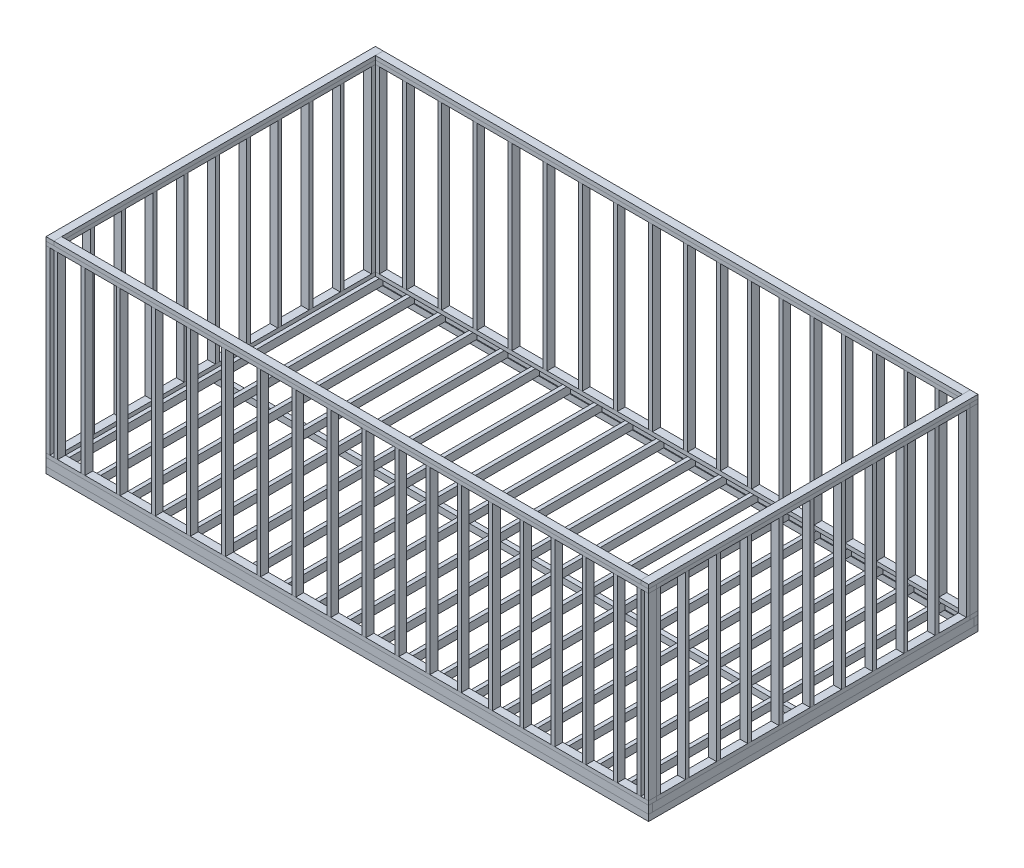
from build123d import *

# Parameters (mm, degrees)
METAL_FRAME_W          = 7720
METAL_FRAME_H          = 4220
METAL_FRAME_W_2        = 7600
METAL_FRAME_H_2        = 2020
METALFRAME_DEPTH       = 80
SKETCH4_W              = 7720
SKETCH4_H              = 50
BOSS_EXTRUDE2_DEPTH    = 100
BOSS_EXTRUDE2_2_DEPTH  = 100
SKETCH4_3_W            = 50
SKETCH4_3_H            = 4120
BOSS_EXTRUDE3_DEPTH    = 100
BOSS_EXTRUDE3_2_DEPTH  = 100
BOSS_EXTRUDE3_3_DEPTH  = 100
BOSS_EXTRUDE3_4_DEPTH  = 100
LPATTERN1_COUNT        = 19
LPATTERN1_PITCH        = 400
SKETCH5_W              = 7720
SKETCH5_H              = 100
BOSS_EXTRUDE4_DEPTH    = 50
BOSS_EXTRUDE4_2_DEPTH  = 50
SKETCH5_4_W            = 100
SKETCH5_4_H            = 4020
BOSS_EXTRUDE5_DEPTH    = 50
BOSS_EXTRUDE5_2_DEPTH  = 50
SKETCH6_W              = 50
SKETCH6_H              = 100
BOSS_EXTRUDE6_DEPTH    = 2300
BOSS_EXTRUDE6_2_DEPTH  = 2300
BOSS_EXTRUDE6_3_DEPTH  = 2300
BOSS_EXTRUDE6_4_DEPTH  = 2300
BOSS_EXTRUDE6_5_DEPTH  = 2300
BOSS_EXTRUDE6_6_DEPTH  = 2300
BOSS_EXTRUDE6_7_DEPTH  = 2300
BOSS_EXTRUDE6_8_DEPTH  = 2300
BOSS_EXTRUDE6_9_DEPTH  = 2300
BOSS_EXTRUDE6_10_DEPTH = 2300
BOSS_EXTRUDE6_11_DEPTH = 2300
BOSS_EXTRUDE6_12_DEPTH = 2300
BOSS_EXTRUDE6_13_DEPTH = 2300
BOSS_EXTRUDE6_14_DEPTH = 2300
BOSS_EXTRUDE6_15_DEPTH = 2300
BOSS_EXTRUDE6_16_DEPTH = 2300
BOSS_EXTRUDE6_17_DEPTH = 2300
BOSS_EXTRUDE6_18_DEPTH = 2300
BOSS_EXTRUDE6_19_DEPTH = 2300
BOSS_EXTRUDE6_20_DEPTH = 2300
BOSS_EXTRUDE6_21_DEPTH = 2300
BOSS_EXTRUDE6_22_DEPTH = 2300
BOSS_EXTRUDE6_23_DEPTH = 2300
BOSS_EXTRUDE6_24_DEPTH = 2300
BOSS_EXTRUDE6_25_DEPTH = 2300
BOSS_EXTRUDE6_26_DEPTH = 2300
BOSS_EXTRUDE6_27_DEPTH = 2300
BOSS_EXTRUDE6_28_DEPTH = 2300
BOSS_EXTRUDE6_29_DEPTH = 2300
BOSS_EXTRUDE6_30_DEPTH = 2300
BOSS_EXTRUDE6_31_DEPTH = 2300
BOSS_EXTRUDE6_32_DEPTH = 2300
BOSS_EXTRUDE6_33_DEPTH = 2300
BOSS_EXTRUDE6_34_DEPTH = 2300
BOSS_EXTRUDE6_35_DEPTH = 2300
BOSS_EXTRUDE6_36_DEPTH = 2300
BOSS_EXTRUDE6_37_DEPTH = 2300
BOSS_EXTRUDE6_38_DEPTH = 2300
SKETCH7_W              = 100
SKETCH7_H              = 50
BOSS_EXTRUDE7_DEPTH    = 2300
BOSS_EXTRUDE7_2_DEPTH  = 2300
BOSS_EXTRUDE7_3_DEPTH  = 2300
BOSS_EXTRUDE7_4_DEPTH  = 2300
BOSS_EXTRUDE7_5_DEPTH  = 2300
BOSS_EXTRUDE7_6_DEPTH  = 2300
BOSS_EXTRUDE7_7_DEPTH  = 2300
BOSS_EXTRUDE7_8_DEPTH  = 2300
BOSS_EXTRUDE7_9_DEPTH  = 2300
BOSS_EXTRUDE7_10_DEPTH = 2300
BOSS_EXTRUDE7_11_DEPTH = 2300
BOSS_EXTRUDE7_12_DEPTH = 2300
BOSS_EXTRUDE7_13_DEPTH = 2300
BOSS_EXTRUDE7_14_DEPTH = 2300
BOSS_EXTRUDE7_15_DEPTH = 2300
BOSS_EXTRUDE7_16_DEPTH = 2300
BOSS_EXTRUDE7_17_DEPTH = 2300
BOSS_EXTRUDE7_18_DEPTH = 2300
BOSS_EXTRUDE7_19_DEPTH = 2300
BOSS_EXTRUDE7_20_DEPTH = 2300
SKETCH8_W              = 100
SKETCH8_H              = 50
BOSS_EXTRUDE8_DEPTH    = 2300
SKETCH8_W_2            = 50
SKETCH8_H_2            = 100
BOSS_EXTRUDE8_2_DEPTH  = 2300
BOSS_EXTRUDE8_3_DEPTH  = 2300
BOSS_EXTRUDE8_4_DEPTH  = 2300
BOSS_EXTRUDE8_5_DEPTH  = 2300
BOSS_EXTRUDE8_6_DEPTH  = 2300
SKETCH9_W              = 100
SKETCH9_H              = 4020
BOSS_EXTRUDE9_DEPTH    = 50
BOSS_EXTRUDE9_2_DEPTH  = 50
SKETCH10_W             = 7720
SKETCH10_H             = 100
BOSS_EXTRUDE10_DEPTH   = 50
BOSS_EXTRUDE10_2_DEPTH = 50
SKETCH11_W             = 100
SKETCH11_H             = 4220
BOSS_EXTRUDE11_DEPTH   = 50
BOSS_EXTRUDE11_2_DEPTH = 50
SKETCH11_3_W           = 7520
SKETCH11_3_H           = 100
BOSS_EXTRUDE12_DEPTH   = 50
SKETCH12_W             = 7520
SKETCH12_H             = 100
BOSS_EXTRUDE13_DEPTH   = 50


with BuildPart() as part:
    # Metal frame → MetalFrame (new body)
    with BuildSketch(Plane(origin=(0, 0, 0), x_dir=(1, 0, 0), z_dir=(0, 1, 0))):
        with Locations((3800, 2050)):
            Rectangle(METAL_FRAME_W, METAL_FRAME_H)
        with Locations((3800, 1010)):
            Rectangle(METAL_FRAME_W_2, METAL_FRAME_H_2, mode=Mode.SUBTRACT)
        with Locations((3800, 3090)):
            Rectangle(METAL_FRAME_W_2, METAL_FRAME_H_2, mode=Mode.SUBTRACT)
    extrude(amount=-METALFRAME_DEPTH)


with BuildPart() as body_2:
    # Sketch4 → Boss-Extrude2 (new body)
    with BuildSketch(Plane(origin=(0, 0, 0), x_dir=(1, 0, 0), z_dir=(0, 1, 0))):
        with Locations((3800, 4135)):
            Rectangle(SKETCH4_W, SKETCH4_H)
    extrude(amount=BOSS_EXTRUDE2_DEPTH)


with BuildPart() as body_3:
    # Sketch4 → Boss-Extrude2 2 (new body)
    with BuildSketch(Plane(origin=(0, 0, 0), x_dir=(1, 0, 0), z_dir=(0, 1, 0))):
        with Locations((3800, -35)):
            Rectangle(SKETCH4_W, SKETCH4_H)
    extrude(amount=BOSS_EXTRUDE2_2_DEPTH)


with BuildPart() as body_4:
    # Sketch4<3> → Boss-Extrude3 (new body)
    with BuildSketch(Plane(origin=(0, 0, 0), x_dir=(1, 0, 0), z_dir=(0, 1, 0))):
        with Locations((-35, 2050)):
            Rectangle(SKETCH4_3_W, SKETCH4_3_H)
    extrude(amount=BOSS_EXTRUDE3_DEPTH)


with BuildPart() as body_5:
    # Sketch4<3> → Boss-Extrude3 2 (new body)
    with BuildSketch(Plane(origin=(0, 0, 0), x_dir=(1, 0, 0), z_dir=(0, 1, 0))):
        with Locations((7635, 2050)):
            Rectangle(SKETCH4_3_W, SKETCH4_3_H)
    extrude(amount=BOSS_EXTRUDE3_2_DEPTH)


with BuildPart() as body_6:
    # Sketch4<3> → Boss-Extrude3 3 (new body)
    with BuildSketch(Plane(origin=(0, 0, 0), x_dir=(1, 0, 0), z_dir=(0, 1, 0))):
        with Locations((65, 2050)):
            Rectangle(SKETCH4_3_W, SKETCH4_3_H)
    extrude(amount=BOSS_EXTRUDE3_3_DEPTH)


with BuildPart() as body_7:
    # Sketch4<3> → Boss-Extrude3 4 (new body)
    with BuildSketch(Plane(origin=(0, 0, 0), x_dir=(1, 0, 0), z_dir=(0, 1, 0))):
        with Locations((7535, 2050)):
            Rectangle(SKETCH4_3_W, SKETCH4_3_H)
    extrude(amount=BOSS_EXTRUDE3_4_DEPTH)


with BuildPart() as lpattern1_1:
    # LPattern1: pattern copy
    add(body_6.part.moved(Location(Vector(1, 0, 0) * (1 * LPATTERN1_PITCH))))


with BuildPart() as lpattern1_2:
    # LPattern1: pattern copy
    add(body_6.part.moved(Location(Vector(1, 0, 0) * (2 * LPATTERN1_PITCH))))


with BuildPart() as lpattern1_3:
    # LPattern1: pattern copy
    add(body_6.part.moved(Location(Vector(1, 0, 0) * (3 * LPATTERN1_PITCH))))


with BuildPart() as lpattern1_4:
    # LPattern1: pattern copy
    add(body_6.part.moved(Location(Vector(1, 0, 0) * (4 * LPATTERN1_PITCH))))


with BuildPart() as lpattern1_5:
    # LPattern1: pattern copy
    add(body_6.part.moved(Location(Vector(1, 0, 0) * (5 * LPATTERN1_PITCH))))


with BuildPart() as lpattern1_6:
    # LPattern1: pattern copy
    add(body_6.part.moved(Location(Vector(1, 0, 0) * (6 * LPATTERN1_PITCH))))


with BuildPart() as lpattern1_7:
    # LPattern1: pattern copy
    add(body_6.part.moved(Location(Vector(1, 0, 0) * (7 * LPATTERN1_PITCH))))


with BuildPart() as lpattern1_8:
    # LPattern1: pattern copy
    add(body_6.part.moved(Location(Vector(1, 0, 0) * (8 * LPATTERN1_PITCH))))


with BuildPart() as lpattern1_9:
    # LPattern1: pattern copy
    add(body_6.part.moved(Location(Vector(1, 0, 0) * (9 * LPATTERN1_PITCH))))


with BuildPart() as lpattern1_10:
    # LPattern1: pattern copy
    add(body_6.part.moved(Location(Vector(1, 0, 0) * (10 * LPATTERN1_PITCH))))


with BuildPart() as lpattern1_11:
    # LPattern1: pattern copy
    add(body_6.part.moved(Location(Vector(1, 0, 0) * (11 * LPATTERN1_PITCH))))


with BuildPart() as lpattern1_12:
    # LPattern1: pattern copy
    add(body_6.part.moved(Location(Vector(1, 0, 0) * (12 * LPATTERN1_PITCH))))


with BuildPart() as lpattern1_13:
    # LPattern1: pattern copy
    add(body_6.part.moved(Location(Vector(1, 0, 0) * (13 * LPATTERN1_PITCH))))


with BuildPart() as lpattern1_14:
    # LPattern1: pattern copy
    add(body_6.part.moved(Location(Vector(1, 0, 0) * (14 * LPATTERN1_PITCH))))


with BuildPart() as lpattern1_15:
    # LPattern1: pattern copy
    add(body_6.part.moved(Location(Vector(1, 0, 0) * (15 * LPATTERN1_PITCH))))


with BuildPart() as lpattern1_16:
    # LPattern1: pattern copy
    add(body_6.part.moved(Location(Vector(1, 0, 0) * (16 * LPATTERN1_PITCH))))


with BuildPart() as lpattern1_17:
    # LPattern1: pattern copy
    add(body_6.part.moved(Location(Vector(1, 0, 0) * (17 * LPATTERN1_PITCH))))


with BuildPart() as lpattern1_18:
    # LPattern1: pattern copy
    add(body_6.part.moved(Location(Vector(1, 0, 0) * (18 * LPATTERN1_PITCH))))


with BuildPart() as body_26:
    # Sketch5 → Boss-Extrude4 (new body)
    with BuildSketch(Plane(origin=(0, 100, 0), x_dir=(1, 0, 0), z_dir=(0, 1, 0))):
        with Locations((3800, 4110)):
            Rectangle(SKETCH5_W, SKETCH5_H)
    extrude(amount=BOSS_EXTRUDE4_DEPTH)


with BuildPart() as body_27:
    # Sketch5 → Boss-Extrude4 2 (new body)
    with BuildSketch(Plane(origin=(0, 100, 0), x_dir=(1, 0, 0), z_dir=(0, 1, 0))):
        with Locations((3800, -10)):
            Rectangle(SKETCH5_W, SKETCH5_H)
    extrude(amount=BOSS_EXTRUDE4_2_DEPTH)


with BuildPart() as body_28:
    # Sketch5<4> → Boss-Extrude5 (new body)
    with BuildSketch(Plane(origin=(0, 100, 0), x_dir=(1, 0, 0), z_dir=(0, 1, 0))):
        with Locations((-10, 2050)):
            Rectangle(SKETCH5_4_W, SKETCH5_4_H)
    extrude(amount=BOSS_EXTRUDE5_DEPTH)


with BuildPart() as body_29:
    # Sketch5<4> → Boss-Extrude5 2 (new body)
    with BuildSketch(Plane(origin=(0, 100, 0), x_dir=(1, 0, 0), z_dir=(0, 1, 0))):
        with Locations((7610, 2050)):
            Rectangle(SKETCH5_4_W, SKETCH5_4_H)
    extrude(amount=BOSS_EXTRUDE5_2_DEPTH)


with BuildPart() as body_30:
    # Sketch6 → Boss-Extrude6 (new body)
    with BuildSketch(Plane(origin=(0, 150, 0), x_dir=(1, 0, 0), z_dir=(0, 1, 0))):
        with Locations((-35, -10)):
            Rectangle(SKETCH6_W, SKETCH6_H)
    extrude(amount=BOSS_EXTRUDE6_DEPTH)


with BuildPart() as body_31:
    # Sketch6 → Boss-Extrude6 2 (new body)
    with BuildSketch(Plane(origin=(0, 150, 0), x_dir=(1, 0, 0), z_dir=(0, 1, 0))):
        with Locations((-35, 4110)):
            Rectangle(SKETCH6_W, SKETCH6_H)
    extrude(amount=BOSS_EXTRUDE6_2_DEPTH)


with BuildPart() as body_32:
    # Sketch6 → Boss-Extrude6 3 (new body)
    with BuildSketch(Plane(origin=(0, 150, 0), x_dir=(1, 0, 0), z_dir=(0, 1, 0))):
        with Locations((415, -10)):
            Rectangle(SKETCH6_W, SKETCH6_H)
    extrude(amount=BOSS_EXTRUDE6_3_DEPTH)


with BuildPart() as body_33:
    # Sketch6 → Boss-Extrude6 4 (new body)
    with BuildSketch(Plane(origin=(0, 150, 0), x_dir=(1, 0, 0), z_dir=(0, 1, 0))):
        with Locations((415, 4110)):
            Rectangle(SKETCH6_W, SKETCH6_H)
    extrude(amount=BOSS_EXTRUDE6_4_DEPTH)


with BuildPart() as body_34:
    # Sketch6 → Boss-Extrude6 5 (new body)
    with BuildSketch(Plane(origin=(0, 150, 0), x_dir=(1, 0, 0), z_dir=(0, 1, 0))):
        with Locations((865, -10)):
            Rectangle(SKETCH6_W, SKETCH6_H)
    extrude(amount=BOSS_EXTRUDE6_5_DEPTH)


with BuildPart() as body_35:
    # Sketch6 → Boss-Extrude6 6 (new body)
    with BuildSketch(Plane(origin=(0, 150, 0), x_dir=(1, 0, 0), z_dir=(0, 1, 0))):
        with Locations((865, 4110)):
            Rectangle(SKETCH6_W, SKETCH6_H)
    extrude(amount=BOSS_EXTRUDE6_6_DEPTH)


with BuildPart() as body_36:
    # Sketch6 → Boss-Extrude6 7 (new body)
    with BuildSketch(Plane(origin=(0, 150, 0), x_dir=(1, 0, 0), z_dir=(0, 1, 0))):
        with Locations((1315, -10)):
            Rectangle(SKETCH6_W, SKETCH6_H)
    extrude(amount=BOSS_EXTRUDE6_7_DEPTH)


with BuildPart() as body_37:
    # Sketch6 → Boss-Extrude6 8 (new body)
    with BuildSketch(Plane(origin=(0, 150, 0), x_dir=(1, 0, 0), z_dir=(0, 1, 0))):
        with Locations((1315, 4110)):
            Rectangle(SKETCH6_W, SKETCH6_H)
    extrude(amount=BOSS_EXTRUDE6_8_DEPTH)


with BuildPart() as body_38:
    # Sketch6 → Boss-Extrude6 9 (new body)
    with BuildSketch(Plane(origin=(0, 150, 0), x_dir=(1, 0, 0), z_dir=(0, 1, 0))):
        with Locations((1765, -10)):
            Rectangle(SKETCH6_W, SKETCH6_H)
    extrude(amount=BOSS_EXTRUDE6_9_DEPTH)


with BuildPart() as body_39:
    # Sketch6 → Boss-Extrude6 10 (new body)
    with BuildSketch(Plane(origin=(0, 150, 0), x_dir=(1, 0, 0), z_dir=(0, 1, 0))):
        with Locations((1765, 4110)):
            Rectangle(SKETCH6_W, SKETCH6_H)
    extrude(amount=BOSS_EXTRUDE6_10_DEPTH)


with BuildPart() as body_40:
    # Sketch6 → Boss-Extrude6 11 (new body)
    with BuildSketch(Plane(origin=(0, 150, 0), x_dir=(1, 0, 0), z_dir=(0, 1, 0))):
        with Locations((2215, -10)):
            Rectangle(SKETCH6_W, SKETCH6_H)
    extrude(amount=BOSS_EXTRUDE6_11_DEPTH)


with BuildPart() as body_41:
    # Sketch6 → Boss-Extrude6 12 (new body)
    with BuildSketch(Plane(origin=(0, 150, 0), x_dir=(1, 0, 0), z_dir=(0, 1, 0))):
        with Locations((2215, 4110)):
            Rectangle(SKETCH6_W, SKETCH6_H)
    extrude(amount=BOSS_EXTRUDE6_12_DEPTH)


with BuildPart() as body_42:
    # Sketch6 → Boss-Extrude6 13 (new body)
    with BuildSketch(Plane(origin=(0, 150, 0), x_dir=(1, 0, 0), z_dir=(0, 1, 0))):
        with Locations((2665, -10)):
            Rectangle(SKETCH6_W, SKETCH6_H)
    extrude(amount=BOSS_EXTRUDE6_13_DEPTH)


with BuildPart() as body_43:
    # Sketch6 → Boss-Extrude6 14 (new body)
    with BuildSketch(Plane(origin=(0, 150, 0), x_dir=(1, 0, 0), z_dir=(0, 1, 0))):
        with Locations((2665, 4110)):
            Rectangle(SKETCH6_W, SKETCH6_H)
    extrude(amount=BOSS_EXTRUDE6_14_DEPTH)


with BuildPart() as body_44:
    # Sketch6 → Boss-Extrude6 15 (new body)
    with BuildSketch(Plane(origin=(0, 150, 0), x_dir=(1, 0, 0), z_dir=(0, 1, 0))):
        with Locations((3115, -10)):
            Rectangle(SKETCH6_W, SKETCH6_H)
    extrude(amount=BOSS_EXTRUDE6_15_DEPTH)


with BuildPart() as body_45:
    # Sketch6 → Boss-Extrude6 16 (new body)
    with BuildSketch(Plane(origin=(0, 150, 0), x_dir=(1, 0, 0), z_dir=(0, 1, 0))):
        with Locations((3115, 4110)):
            Rectangle(SKETCH6_W, SKETCH6_H)
    extrude(amount=BOSS_EXTRUDE6_16_DEPTH)


with BuildPart() as body_46:
    # Sketch6 → Boss-Extrude6 17 (new body)
    with BuildSketch(Plane(origin=(0, 150, 0), x_dir=(1, 0, 0), z_dir=(0, 1, 0))):
        with Locations((3565, -10)):
            Rectangle(SKETCH6_W, SKETCH6_H)
    extrude(amount=BOSS_EXTRUDE6_17_DEPTH)


with BuildPart() as body_47:
    # Sketch6 → Boss-Extrude6 18 (new body)
    with BuildSketch(Plane(origin=(0, 150, 0), x_dir=(1, 0, 0), z_dir=(0, 1, 0))):
        with Locations((3565, 4110)):
            Rectangle(SKETCH6_W, SKETCH6_H)
    extrude(amount=BOSS_EXTRUDE6_18_DEPTH)


with BuildPart() as body_48:
    # Sketch6 → Boss-Extrude6 19 (new body)
    with BuildSketch(Plane(origin=(0, 150, 0), x_dir=(1, 0, 0), z_dir=(0, 1, 0))):
        with Locations((4015, -10)):
            Rectangle(SKETCH6_W, SKETCH6_H)
    extrude(amount=BOSS_EXTRUDE6_19_DEPTH)


with BuildPart() as body_49:
    # Sketch6 → Boss-Extrude6 20 (new body)
    with BuildSketch(Plane(origin=(0, 150, 0), x_dir=(1, 0, 0), z_dir=(0, 1, 0))):
        with Locations((4015, 4110)):
            Rectangle(SKETCH6_W, SKETCH6_H)
    extrude(amount=BOSS_EXTRUDE6_20_DEPTH)


with BuildPart() as body_50:
    # Sketch6 → Boss-Extrude6 21 (new body)
    with BuildSketch(Plane(origin=(0, 150, 0), x_dir=(1, 0, 0), z_dir=(0, 1, 0))):
        with Locations((7635, 4110)):
            Rectangle(SKETCH6_W, SKETCH6_H)
    extrude(amount=BOSS_EXTRUDE6_21_DEPTH)


with BuildPart() as body_51:
    # Sketch6 → Boss-Extrude6 22 (new body)
    with BuildSketch(Plane(origin=(0, 150, 0), x_dir=(1, 0, 0), z_dir=(0, 1, 0))):
        with Locations((7635, -10)):
            Rectangle(SKETCH6_W, SKETCH6_H)
    extrude(amount=BOSS_EXTRUDE6_22_DEPTH)


with BuildPart() as body_52:
    # Sketch6 → Boss-Extrude6 23 (new body)
    with BuildSketch(Plane(origin=(0, 150, 0), x_dir=(1, 0, 0), z_dir=(0, 1, 0))):
        with Locations((7235, -10)):
            Rectangle(SKETCH6_W, SKETCH6_H)
    extrude(amount=BOSS_EXTRUDE6_23_DEPTH)


with BuildPart() as body_53:
    # Sketch6 → Boss-Extrude6 24 (new body)
    with BuildSketch(Plane(origin=(0, 150, 0), x_dir=(1, 0, 0), z_dir=(0, 1, 0))):
        with Locations((7235, 4110)):
            Rectangle(SKETCH6_W, SKETCH6_H)
    extrude(amount=BOSS_EXTRUDE6_24_DEPTH)


with BuildPart() as body_54:
    # Sketch6 → Boss-Extrude6 25 (new body)
    with BuildSketch(Plane(origin=(0, 150, 0), x_dir=(1, 0, 0), z_dir=(0, 1, 0))):
        with Locations((6835, -10)):
            Rectangle(SKETCH6_W, SKETCH6_H)
    extrude(amount=BOSS_EXTRUDE6_25_DEPTH)


with BuildPart() as body_55:
    # Sketch6 → Boss-Extrude6 26 (new body)
    with BuildSketch(Plane(origin=(0, 150, 0), x_dir=(1, 0, 0), z_dir=(0, 1, 0))):
        with Locations((6835, 4110)):
            Rectangle(SKETCH6_W, SKETCH6_H)
    extrude(amount=BOSS_EXTRUDE6_26_DEPTH)


with BuildPart() as body_56:
    # Sketch6 → Boss-Extrude6 27 (new body)
    with BuildSketch(Plane(origin=(0, 150, 0), x_dir=(1, 0, 0), z_dir=(0, 1, 0))):
        with Locations((6435, -10)):
            Rectangle(SKETCH6_W, SKETCH6_H)
    extrude(amount=BOSS_EXTRUDE6_27_DEPTH)


with BuildPart() as body_57:
    # Sketch6 → Boss-Extrude6 28 (new body)
    with BuildSketch(Plane(origin=(0, 150, 0), x_dir=(1, 0, 0), z_dir=(0, 1, 0))):
        with Locations((6435, 4110)):
            Rectangle(SKETCH6_W, SKETCH6_H)
    extrude(amount=BOSS_EXTRUDE6_28_DEPTH)


with BuildPart() as body_58:
    # Sketch6 → Boss-Extrude6 29 (new body)
    with BuildSketch(Plane(origin=(0, 150, 0), x_dir=(1, 0, 0), z_dir=(0, 1, 0))):
        with Locations((6035, -10)):
            Rectangle(SKETCH6_W, SKETCH6_H)
    extrude(amount=BOSS_EXTRUDE6_29_DEPTH)


with BuildPart() as body_59:
    # Sketch6 → Boss-Extrude6 30 (new body)
    with BuildSketch(Plane(origin=(0, 150, 0), x_dir=(1, 0, 0), z_dir=(0, 1, 0))):
        with Locations((6035, 4110)):
            Rectangle(SKETCH6_W, SKETCH6_H)
    extrude(amount=BOSS_EXTRUDE6_30_DEPTH)


with BuildPart() as body_60:
    # Sketch6 → Boss-Extrude6 31 (new body)
    with BuildSketch(Plane(origin=(0, 150, 0), x_dir=(1, 0, 0), z_dir=(0, 1, 0))):
        with Locations((5635, -10)):
            Rectangle(SKETCH6_W, SKETCH6_H)
    extrude(amount=BOSS_EXTRUDE6_31_DEPTH)


with BuildPart() as body_61:
    # Sketch6 → Boss-Extrude6 32 (new body)
    with BuildSketch(Plane(origin=(0, 150, 0), x_dir=(1, 0, 0), z_dir=(0, 1, 0))):
        with Locations((5635, 4110)):
            Rectangle(SKETCH6_W, SKETCH6_H)
    extrude(amount=BOSS_EXTRUDE6_32_DEPTH)


with BuildPart() as body_62:
    # Sketch6 → Boss-Extrude6 33 (new body)
    with BuildSketch(Plane(origin=(0, 150, 0), x_dir=(1, 0, 0), z_dir=(0, 1, 0))):
        with Locations((5235, -10)):
            Rectangle(SKETCH6_W, SKETCH6_H)
    extrude(amount=BOSS_EXTRUDE6_33_DEPTH)


with BuildPart() as body_63:
    # Sketch6 → Boss-Extrude6 34 (new body)
    with BuildSketch(Plane(origin=(0, 150, 0), x_dir=(1, 0, 0), z_dir=(0, 1, 0))):
        with Locations((5235, 4110)):
            Rectangle(SKETCH6_W, SKETCH6_H)
    extrude(amount=BOSS_EXTRUDE6_34_DEPTH)


with BuildPart() as body_64:
    # Sketch6 → Boss-Extrude6 35 (new body)
    with BuildSketch(Plane(origin=(0, 150, 0), x_dir=(1, 0, 0), z_dir=(0, 1, 0))):
        with Locations((4835, -10)):
            Rectangle(SKETCH6_W, SKETCH6_H)
    extrude(amount=BOSS_EXTRUDE6_35_DEPTH)


with BuildPart() as body_65:
    # Sketch6 → Boss-Extrude6 36 (new body)
    with BuildSketch(Plane(origin=(0, 150, 0), x_dir=(1, 0, 0), z_dir=(0, 1, 0))):
        with Locations((4835, 4110)):
            Rectangle(SKETCH6_W, SKETCH6_H)
    extrude(amount=BOSS_EXTRUDE6_36_DEPTH)


with BuildPart() as body_66:
    # Sketch6 → Boss-Extrude6 37 (new body)
    with BuildSketch(Plane(origin=(0, 150, 0), x_dir=(1, 0, 0), z_dir=(0, 1, 0))):
        with Locations((4435, -10)):
            Rectangle(SKETCH6_W, SKETCH6_H)
    extrude(amount=BOSS_EXTRUDE6_37_DEPTH)


with BuildPart() as body_67:
    # Sketch6 → Boss-Extrude6 38 (new body)
    with BuildSketch(Plane(origin=(0, 150, 0), x_dir=(1, 0, 0), z_dir=(0, 1, 0))):
        with Locations((4435, 4110)):
            Rectangle(SKETCH6_W, SKETCH6_H)
    extrude(amount=BOSS_EXTRUDE6_38_DEPTH)


with BuildPart() as body_68:
    # Sketch7 → Boss-Extrude7 (new body)
    with BuildSketch(Plane(origin=(0, 150, 0), x_dir=(1, 0, 0), z_dir=(0, 1, 0))):
        with Locations((-10, 4035)):
            Rectangle(SKETCH7_W, SKETCH7_H)
    extrude(amount=BOSS_EXTRUDE7_DEPTH)


with BuildPart() as body_69:
    # Sketch7 → Boss-Extrude7 2 (new body)
    with BuildSketch(Plane(origin=(0, 150, 0), x_dir=(1, 0, 0), z_dir=(0, 1, 0))):
        with Locations((7610, 4035)):
            Rectangle(SKETCH7_W, SKETCH7_H)
    extrude(amount=BOSS_EXTRUDE7_2_DEPTH)


with BuildPart() as body_70:
    # Sketch7 → Boss-Extrude7 3 (new body)
    with BuildSketch(Plane(origin=(0, 150, 0), x_dir=(1, 0, 0), z_dir=(0, 1, 0))):
        with Locations((-10, 3635)):
            Rectangle(SKETCH7_W, SKETCH7_H)
    extrude(amount=BOSS_EXTRUDE7_3_DEPTH)


with BuildPart() as body_71:
    # Sketch7 → Boss-Extrude7 4 (new body)
    with BuildSketch(Plane(origin=(0, 150, 0), x_dir=(1, 0, 0), z_dir=(0, 1, 0))):
        with Locations((7610, 3635)):
            Rectangle(SKETCH7_W, SKETCH7_H)
    extrude(amount=BOSS_EXTRUDE7_4_DEPTH)


with BuildPart() as body_72:
    # Sketch7 → Boss-Extrude7 5 (new body)
    with BuildSketch(Plane(origin=(0, 150, 0), x_dir=(1, 0, 0), z_dir=(0, 1, 0))):
        with Locations((-10, 3235)):
            Rectangle(SKETCH7_W, SKETCH7_H)
    extrude(amount=BOSS_EXTRUDE7_5_DEPTH)


with BuildPart() as body_73:
    # Sketch7 → Boss-Extrude7 6 (new body)
    with BuildSketch(Plane(origin=(0, 150, 0), x_dir=(1, 0, 0), z_dir=(0, 1, 0))):
        with Locations((7610, 3235)):
            Rectangle(SKETCH7_W, SKETCH7_H)
    extrude(amount=BOSS_EXTRUDE7_6_DEPTH)


with BuildPart() as body_74:
    # Sketch7 → Boss-Extrude7 7 (new body)
    with BuildSketch(Plane(origin=(0, 150, 0), x_dir=(1, 0, 0), z_dir=(0, 1, 0))):
        with Locations((-10, 2835)):
            Rectangle(SKETCH7_W, SKETCH7_H)
    extrude(amount=BOSS_EXTRUDE7_7_DEPTH)


with BuildPart() as body_75:
    # Sketch7 → Boss-Extrude7 8 (new body)
    with BuildSketch(Plane(origin=(0, 150, 0), x_dir=(1, 0, 0), z_dir=(0, 1, 0))):
        with Locations((7610, 2835)):
            Rectangle(SKETCH7_W, SKETCH7_H)
    extrude(amount=BOSS_EXTRUDE7_8_DEPTH)


with BuildPart() as body_76:
    # Sketch7 → Boss-Extrude7 9 (new body)
    with BuildSketch(Plane(origin=(0, 150, 0), x_dir=(1, 0, 0), z_dir=(0, 1, 0))):
        with Locations((-10, 2435)):
            Rectangle(SKETCH7_W, SKETCH7_H)
    extrude(amount=BOSS_EXTRUDE7_9_DEPTH)


with BuildPart() as body_77:
    # Sketch7 → Boss-Extrude7 10 (new body)
    with BuildSketch(Plane(origin=(0, 150, 0), x_dir=(1, 0, 0), z_dir=(0, 1, 0))):
        with Locations((7610, 2435)):
            Rectangle(SKETCH7_W, SKETCH7_H)
    extrude(amount=BOSS_EXTRUDE7_10_DEPTH)


with BuildPart() as body_78:
    # Sketch7 → Boss-Extrude7 11 (new body)
    with BuildSketch(Plane(origin=(0, 150, 0), x_dir=(1, 0, 0), z_dir=(0, 1, 0))):
        with Locations((-10, 2035)):
            Rectangle(SKETCH7_W, SKETCH7_H)
    extrude(amount=BOSS_EXTRUDE7_11_DEPTH)


with BuildPart() as body_79:
    # Sketch7 → Boss-Extrude7 12 (new body)
    with BuildSketch(Plane(origin=(0, 150, 0), x_dir=(1, 0, 0), z_dir=(0, 1, 0))):
        with Locations((7610, 2035)):
            Rectangle(SKETCH7_W, SKETCH7_H)
    extrude(amount=BOSS_EXTRUDE7_12_DEPTH)


with BuildPart() as body_80:
    # Sketch7 → Boss-Extrude7 13 (new body)
    with BuildSketch(Plane(origin=(0, 150, 0), x_dir=(1, 0, 0), z_dir=(0, 1, 0))):
        with Locations((-10, 1635)):
            Rectangle(SKETCH7_W, SKETCH7_H)
    extrude(amount=BOSS_EXTRUDE7_13_DEPTH)


with BuildPart() as body_81:
    # Sketch7 → Boss-Extrude7 14 (new body)
    with BuildSketch(Plane(origin=(0, 150, 0), x_dir=(1, 0, 0), z_dir=(0, 1, 0))):
        with Locations((7610, 1635)):
            Rectangle(SKETCH7_W, SKETCH7_H)
    extrude(amount=BOSS_EXTRUDE7_14_DEPTH)


with BuildPart() as body_82:
    # Sketch7 → Boss-Extrude7 15 (new body)
    with BuildSketch(Plane(origin=(0, 150, 0), x_dir=(1, 0, 0), z_dir=(0, 1, 0))):
        with Locations((-10, 1235)):
            Rectangle(SKETCH7_W, SKETCH7_H)
    extrude(amount=BOSS_EXTRUDE7_15_DEPTH)


with BuildPart() as body_83:
    # Sketch7 → Boss-Extrude7 16 (new body)
    with BuildSketch(Plane(origin=(0, 150, 0), x_dir=(1, 0, 0), z_dir=(0, 1, 0))):
        with Locations((7610, 1235)):
            Rectangle(SKETCH7_W, SKETCH7_H)
    extrude(amount=BOSS_EXTRUDE7_16_DEPTH)


with BuildPart() as body_84:
    # Sketch7 → Boss-Extrude7 17 (new body)
    with BuildSketch(Plane(origin=(0, 150, 0), x_dir=(1, 0, 0), z_dir=(0, 1, 0))):
        with Locations((-10, 835)):
            Rectangle(SKETCH7_W, SKETCH7_H)
    extrude(amount=BOSS_EXTRUDE7_17_DEPTH)


with BuildPart() as body_85:
    # Sketch7 → Boss-Extrude7 18 (new body)
    with BuildSketch(Plane(origin=(0, 150, 0), x_dir=(1, 0, 0), z_dir=(0, 1, 0))):
        with Locations((7610, 835)):
            Rectangle(SKETCH7_W, SKETCH7_H)
    extrude(amount=BOSS_EXTRUDE7_18_DEPTH)


with BuildPart() as body_86:
    # Sketch7 → Boss-Extrude7 19 (new body)
    with BuildSketch(Plane(origin=(0, 150, 0), x_dir=(1, 0, 0), z_dir=(0, 1, 0))):
        with Locations((-10, 435)):
            Rectangle(SKETCH7_W, SKETCH7_H)
    extrude(amount=BOSS_EXTRUDE7_19_DEPTH)


with BuildPart() as body_87:
    # Sketch7 → Boss-Extrude7 20 (new body)
    with BuildSketch(Plane(origin=(0, 150, 0), x_dir=(1, 0, 0), z_dir=(0, 1, 0))):
        with Locations((7610, 435)):
            Rectangle(SKETCH7_W, SKETCH7_H)
    extrude(amount=BOSS_EXTRUDE7_20_DEPTH)


with BuildPart() as body_88:
    # Sketch8 → Boss-Extrude8 (new body)
    with BuildSketch(Plane(origin=(0, 150, 0), x_dir=(1, 0, 0), z_dir=(0, 1, 0))):
        with Locations((-10, 65)):
            Rectangle(SKETCH8_W, SKETCH8_H)
    extrude(amount=BOSS_EXTRUDE8_DEPTH)


with BuildPart() as body_89:
    # Sketch8 → Boss-Extrude8 2 (new body)
    with BuildSketch(Plane(origin=(0, 150, 0), x_dir=(1, 0, 0), z_dir=(0, 1, 0))):
        with Locations((65, 4110)):
            Rectangle(SKETCH8_W_2, SKETCH8_H_2)
    extrude(amount=BOSS_EXTRUDE8_2_DEPTH)


with BuildPart() as body_90:
    # Sketch8 → Boss-Extrude8 3 (new body)
    with BuildSketch(Plane(origin=(0, 150, 0), x_dir=(1, 0, 0), z_dir=(0, 1, 0))):
        with Locations((65, -10)):
            Rectangle(SKETCH8_W_2, SKETCH8_H_2)
    extrude(amount=BOSS_EXTRUDE8_3_DEPTH)


with BuildPart() as body_91:
    # Sketch8 → Boss-Extrude8 4 (new body)
    with BuildSketch(Plane(origin=(0, 150, 0), x_dir=(1, 0, 0), z_dir=(0, 1, 0))):
        with Locations((7535, -10)):
            Rectangle(SKETCH8_W_2, SKETCH8_H_2)
    extrude(amount=BOSS_EXTRUDE8_4_DEPTH)


with BuildPart() as body_92:
    # Sketch8 → Boss-Extrude8 5 (new body)
    with BuildSketch(Plane(origin=(0, 150, 0), x_dir=(1, 0, 0), z_dir=(0, 1, 0))):
        with Locations((7610, 65)):
            Rectangle(SKETCH8_W, SKETCH8_H)
    extrude(amount=BOSS_EXTRUDE8_5_DEPTH)


with BuildPart() as body_93:
    # Sketch8 → Boss-Extrude8 6 (new body)
    with BuildSketch(Plane(origin=(0, 150, 0), x_dir=(1, 0, 0), z_dir=(0, 1, 0))):
        with Locations((7535, 4110)):
            Rectangle(SKETCH8_W_2, SKETCH8_H_2)
    extrude(amount=BOSS_EXTRUDE8_6_DEPTH)


with BuildPart() as body_94:
    # Sketch9 → Boss-Extrude9 (new body)
    with BuildSketch(Plane(origin=(0, 2450, 0), x_dir=(1, 0, 0), z_dir=(0, 1, 0))):
        with Locations((-10, 2050)):
            Rectangle(SKETCH9_W, SKETCH9_H)
    extrude(amount=BOSS_EXTRUDE9_DEPTH)


with BuildPart() as body_95:
    # Sketch9 → Boss-Extrude9 2 (new body)
    with BuildSketch(Plane(origin=(0, 2450, 0), x_dir=(1, 0, 0), z_dir=(0, 1, 0))):
        with Locations((7610, 2050)):
            Rectangle(SKETCH9_W, SKETCH9_H)
    extrude(amount=BOSS_EXTRUDE9_2_DEPTH)


with BuildPart() as body_96:
    # Sketch10 → Boss-Extrude10 (new body)
    with BuildSketch(Plane(origin=(0, 2450, 0), x_dir=(1, 0, 0), z_dir=(0, 1, 0))):
        with Locations((3800, 4110)):
            Rectangle(SKETCH10_W, SKETCH10_H)
    extrude(amount=BOSS_EXTRUDE10_DEPTH)


with BuildPart() as body_97:
    # Sketch10 → Boss-Extrude10 2 (new body)
    with BuildSketch(Plane(origin=(0, 2450, 0), x_dir=(1, 0, 0), z_dir=(0, 1, 0))):
        with Locations((3800, -10)):
            Rectangle(SKETCH10_W, SKETCH10_H)
    extrude(amount=BOSS_EXTRUDE10_2_DEPTH)


with BuildPart() as body_98:
    # Sketch11 → Boss-Extrude11 (new body)
    with BuildSketch(Plane(origin=(0, 2500, 0), x_dir=(1, 0, 0), z_dir=(0, 1, 0))):
        with Locations((-10, 2050)):
            Rectangle(SKETCH11_W, SKETCH11_H)
    extrude(amount=BOSS_EXTRUDE11_DEPTH)


with BuildPart() as body_99:
    # Sketch11 → Boss-Extrude11 2 (new body)
    with BuildSketch(Plane(origin=(0, 2500, 0), x_dir=(1, 0, 0), z_dir=(0, 1, 0))):
        with Locations((7610, 2050)):
            Rectangle(SKETCH11_W, SKETCH11_H)
    extrude(amount=BOSS_EXTRUDE11_2_DEPTH)


with BuildPart() as body_100:
    # Sketch11<3> → Boss-Extrude12 (new body)
    with BuildSketch(Plane(origin=(0, 2500, 0), x_dir=(1, 0, 0), z_dir=(0, 1, 0))):
        with Locations((3800, 4110)):
            Rectangle(SKETCH11_3_W, SKETCH11_3_H)
    extrude(amount=BOSS_EXTRUDE12_DEPTH)


with BuildPart() as body_101:
    # Sketch12 → Boss-Extrude13 (new body)
    with BuildSketch(Plane(origin=(0, 2500, 0), x_dir=(1, 0, 0), z_dir=(0, 1, 0))):
        with Locations((3800, -10)):
            Rectangle(SKETCH12_W, SKETCH12_H)
    extrude(amount=BOSS_EXTRUDE13_DEPTH)


solid = Compound([part.part, body_2.part, body_3.part, body_4.part, body_5.part, body_6.part, body_7.part, lpattern1_1.part, lpattern1_2.part, lpattern1_3.part, lpattern1_4.part, lpattern1_5.part, lpattern1_6.part, lpattern1_7.part, lpattern1_8.part, lpattern1_9.part, lpattern1_10.part, lpattern1_11.part, lpattern1_12.part, lpattern1_13.part, lpattern1_14.part, lpattern1_15.part, lpattern1_16.part, lpattern1_17.part, lpattern1_18.part, body_26.part, body_27.part, body_28.part, body_29.part, body_30.part, body_31.part, body_32.part, body_33.part, body_34.part, body_35.part, body_36.part, body_37.part, body_38.part, body_39.part, body_40.part, body_41.part, body_42.part, body_43.part, body_44.part, body_45.part, body_46.part, body_47.part, body_48.part, body_49.part, body_50.part, body_51.part, body_52.part, body_53.part, body_54.part, body_55.part, body_56.part, body_57.part, body_58.part, body_59.part, body_60.part, body_61.part, body_62.part, body_63.part, body_64.part, body_65.part, body_66.part, body_67.part, body_68.part, body_69.part, body_70.part, body_71.part, body_72.part, body_73.part, body_74.part, body_75.part, body_76.part, body_77.part, body_78.part, body_79.part, body_80.part, body_81.part, body_82.part, body_83.part, body_84.part, body_85.part, body_86.part, body_87.part, body_88.part, body_89.part, body_90.part, body_91.part, body_92.part, body_93.part, body_94.part, body_95.part, body_96.part, body_97.part, body_98.part, body_99.part, body_100.part, body_101.part])
